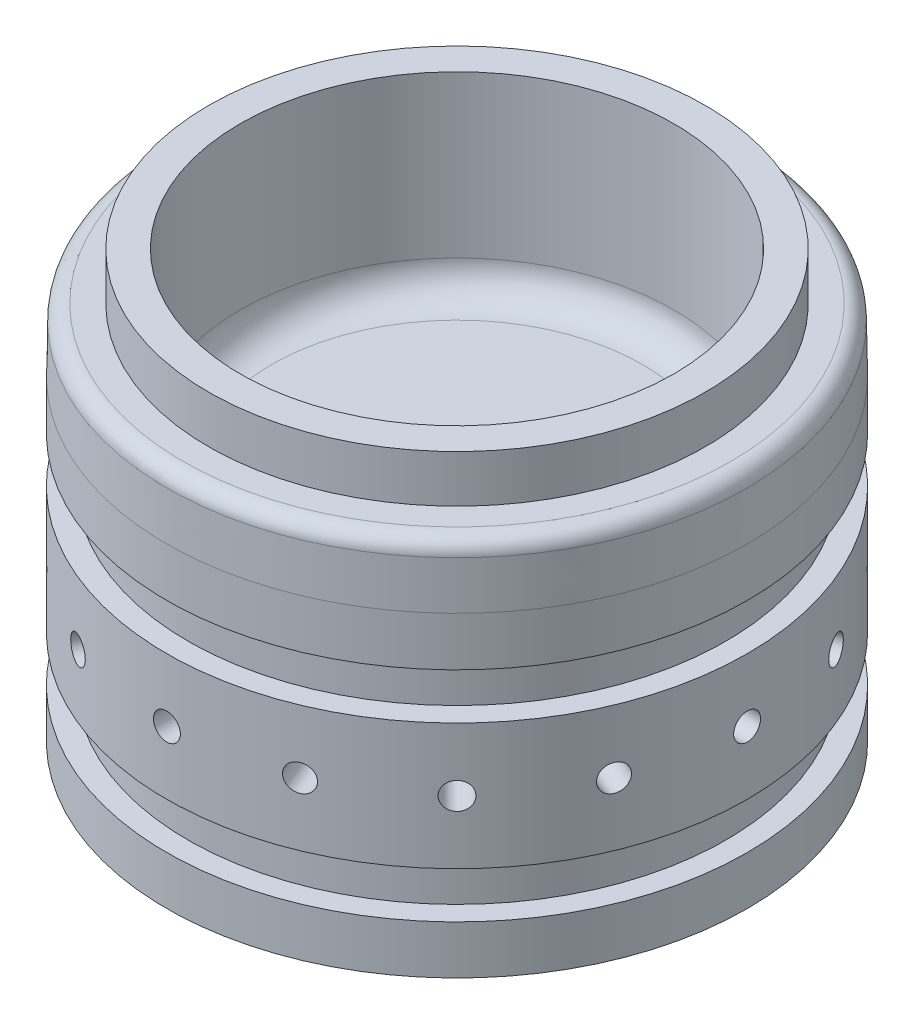
from build123d import *

# Parameters (mm, degrees)
TAPERFILLET_R     = 3.175
HOLEPATTERN_COUNT = 16
POCKETFILLETS_R   = 6.35


with BuildPart() as part:
    # Sketch1 → Revolve1 (revolve)
    with BuildSketch(Plane.XY):
        Polygon((0, -15.24), (0, 15.24), (-43.6499, 15.24), (-43.6499, 54.0512), (-49.9999, 54.0512), (-49.9999, 44.5262), (-58.236420675, 44.5262), (-58.4581, 31.8262), (-58.4581, 21.971), (-54.1401, 21.971), (-54.1401, 12.7), (-58.4581, 12.7), (-58.4581, -12.7), (-54.1401, -12.7), (-54.1401, -21.971), (-58.4581, -21.971), (-58.4581, -31.75), (-48.9331, -31.75), (-48.9331, -15.24), align=None)
    revolve(axis=Axis((0, 31.75, 0), (0, -1, 0)))

    # TaperFillet
    taperfillet_edges = [part.edges().sort_by_distance(p)[0] for p in [
        (58.236420675, 44.5262, 0),
    ]]
    fillet(taperfillet_edges, radius=TAPERFILLET_R)

    # Sketch4 → Tap Drill for 1/4-28 Tap1 (revolve, cut)
    with BuildSketch(Plane(origin=(0, 0, -58.4581), x_dir=(0, 1, 0), z_dir=(1, 0, 0))):
        Polygon((0, 0), (0, 20.675388061), (2.7051, 19.05), (2.7051, 0), align=None)
    tap_drill_for_1_4_28_tap1 = revolve(axis=Axis((0, 0, -64.8081), (0, 0, 1)), mode=Mode.SUBTRACT)

    # HolePattern: Tap Drill for 1/4-28 Tap1 ×16 about axis
    holepattern_axis = Axis((0, -12.7, 0), (0, 1, 0))
    for i in range(1, HOLEPATTERN_COUNT):
        add(tap_drill_for_1_4_28_tap1.rotate(holepattern_axis, i * 360 / HOLEPATTERN_COUNT), mode=Mode.SUBTRACT)

    # PocketFillets
    pocketfillets_edges = [part.edges().sort_by_distance(p)[0] for p in [
        (43.6499, 15.24, 0),
        (48.9331, -15.24, 0),
    ]]
    fillet(pocketfillets_edges, radius=POCKETFILLETS_R)


solid = part.part
